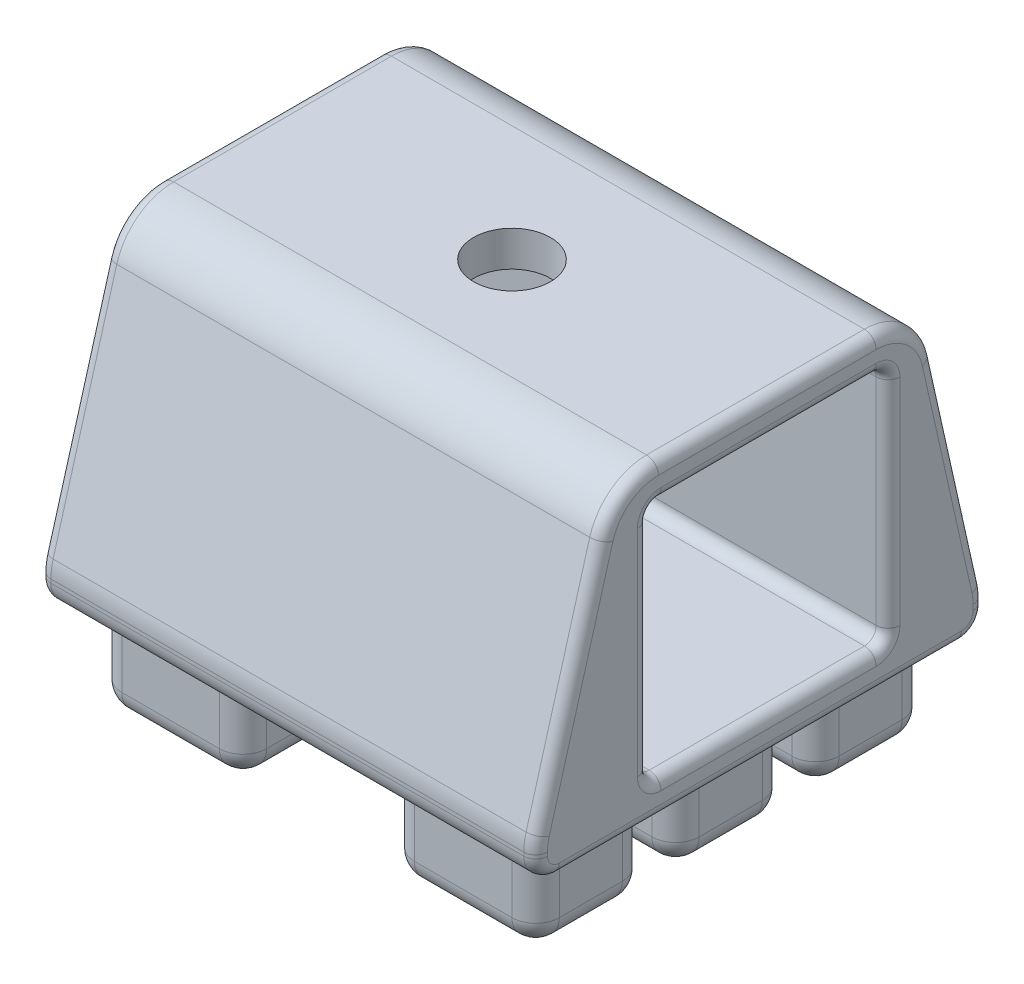
from build123d import *

# Parameters (mm, degrees)
ESBO_O1_W                = 42
ESBO_O1_H                = 38
RESSALTO_EXTRUS_O1_DEPTH = 1.5
ESBO_O2_W                = 12.25
ESBO_O2_H                = 9.333333333
ESBO_O2_H_2              = 9.333333334
RESSALTO_EXTRUS_O2_DEPTH = 7.5
FILETE1_R                = 2
RESSALTO_EXTRUS_O3_START = -21
ESBO_O5_W                = 26.2
ESBO_O5_H                = 26.2
ESBO_O5_W_2              = 20.2
ESBO_O5_H_2              = 20.2
RESSALTO_EXTRUS_O3_DEPTH = 42
ESBO_O3_R                = 3.25
CORTE_EXTRUS_O1_DEPTH    = 39.580305857
LOFT3_START              = -21
LOFT3_DEPTH              = 42
LOFT4_START              = -21
LOFT4_DEPTH              = 42
FILETE8_START            = -22
FILETE8_DEPTH            = 44
FILETE9_R                = 1
FILETE10_R               = 1
FILETE11_R               = 2


with BuildPart() as part:
    # Esboço1 → Ressalto-extrusão1 (new, symmetric)
    with BuildSketch(Plane(origin=(0, 0, 0), x_dir=(1, 0, 0), z_dir=(0, 1, 0))):
        Rectangle(ESBO_O1_W, ESBO_O1_H)
    extrude(amount=RESSALTO_EXTRUS_O1_DEPTH, both=True)

    # Esboço2 → Ressalto-extrusão2 (add)
    with BuildSketch(Plane.XZ.offset(1.5)):
        with Locations((-12.375, 11.833333334)):
            Rectangle(ESBO_O2_W, ESBO_O2_H)
        with Locations((-12.375, 0)):
            Rectangle(ESBO_O2_W, ESBO_O2_H_2)
        with Locations((12.375, 11.833333334)):
            Rectangle(ESBO_O2_W, ESBO_O2_H)
        with Locations((12.375, 0)):
            Rectangle(ESBO_O2_W, ESBO_O2_H_2)
        with Locations((-12.375, -11.833333334)):
            Rectangle(ESBO_O2_W, ESBO_O2_H)
        with Locations((12.375, -11.833333334)):
            Rectangle(ESBO_O2_W, ESBO_O2_H)
    extrude(amount=RESSALTO_EXTRUS_O2_DEPTH)

    # Filete1
    filete1_edges = [part.edges().sort_by_distance(p)[0] for p in [
        (-6.25, -5.25, 7.166666667),
        (-6.25, -5.25, 16.5),
        (-18.5, -5.25, 16.5),
        (-18.5, -5.25, 7.166666667),
        (-6.25, -9, 11.833333333),
        (-12.375, -9, 16.5),
        (-18.5, -9, 11.833333333),
        (-12.375, -9, 7.166666667),
        (18.5, -5.25, 7.166666667),
        (18.5, -5.25, 16.5),
        (6.25, -5.25, 16.5),
        (6.25, -5.25, 7.166666667),
        (18.5, -9, 11.833333333),
        (12.375, -9, 16.5),
        (6.25, -9, 11.833333333),
        (12.375, -9, 7.166666667),
        (-6.25, -5.25, -4.666666667),
        (-6.25, -5.25, 4.666666667),
        (-18.5, -5.25, 4.666666667),
        (-18.5, -5.25, -4.666666667),
        (-6.25, -9, 0),
        (-12.375, -9, 4.666666667),
        (-18.5, -9, 0),
        (-12.375, -9, -4.666666667),
        (18.5, -5.25, -4.666666667),
        (18.5, -5.25, 4.666666667),
        (6.25, -5.25, 4.666666667),
        (6.25, -5.25, -4.666666667),
        (18.5, -9, 0),
        (12.375, -9, 4.666666667),
        (6.25, -9, 0),
        (12.375, -9, -4.666666667),
        (-6.25, -5.25, -16.5),
        (-6.25, -5.25, -7.166666667),
        (-18.5, -5.25, -7.166666667),
        (-18.5, -5.25, -16.5),
        (-6.25, -9, -11.833333333),
        (-12.375, -9, -7.166666667),
        (-18.5, -9, -11.833333333),
        (-12.375, -9, -16.5),
        (18.5, -5.25, -16.5),
        (18.5, -5.25, -7.166666667),
        (6.25, -5.25, -7.166666667),
        (6.25, -5.25, -16.5),
        (18.5, -9, -11.833333333),
        (12.375, -9, -7.166666667),
        (6.25, -9, -11.833333333),
        (12.375, -9, -16.5),
    ]]
    fillet(filete1_edges, radius=FILETE1_R)

    # Esboço5 → Ressalto-extrusão3 (add)
    with BuildSketch(Plane(origin=(0, 0, 0), x_dir=(0, 0, -1), z_dir=(1, 0, 0)).offset(RESSALTO_EXTRUS_O3_START)):
        with Locations((0.705873589, 11.6)):
            Rectangle(ESBO_O5_W, ESBO_O5_H)
        with Locations((0.705873589, 11.6)):
            Rectangle(ESBO_O5_W_2, ESBO_O5_H_2, mode=Mode.SUBTRACT)
    extrude(amount=RESSALTO_EXTRUS_O3_DEPTH)

    # Esboço3 → Corte-extrusão1 (cut, through all)
    with BuildSketch(Plane.XZ.offset(1.5)):
        with Locations(Location((0, 0, 0), (0, 0, 270))):
            Circle(ESBO_O3_R)
    extrude(amount=-CORTE_EXTRUS_O1_DEPTH, mode=Mode.SUBTRACT)

    # Loft3: read off the stored shape, not the designer's step
    # Loft3 outline → Loft3 (add)
    with BuildSketch(Plane.YZ.offset(LOFT3_START)):
        Polygon((1.5, 12.394126411), (24.7, 12.394126411), (1.5, 19), align=None)
    extrude(amount=LOFT3_DEPTH)

    # Loft4: read off the stored shape, not the designer's step
    # Loft4 outline → Loft4 (add)
    with BuildSketch(Plane.YZ.offset(LOFT4_START)):
        Polygon((1.5, -13.805873589), (1.5, -19), (24.70005, -13.805862395), align=None)
    extrude(amount=LOFT4_DEPTH)

    # Filete8: read off the stored shape, not the designer's step
    # Filete8 outline → Filete8 (cut)
    with BuildSketch(Plane.YZ.offset(FILETE8_START)):
        with BuildLine():
            ThreePointArc((0.802031375, 19), (1.49329735, 18.951984587), (2.171286756, 18.808860541))
            Line((2.171286756, 18.808860541), (1.5, 19))
            Line((1.5, 19), (0.802031375, 19))
        make_face()
        with BuildLine():
            ThreePointArc((21.069255381, 13.427929858), (23.69038074, 11.631852341), (24.7, 8.619069318))
            Line((24.7, 8.619069318), (24.7, 12.394126411))
            Line((24.7, 12.394126411), (21.069255381, 13.427929858))
        make_face()
        with BuildLine():
            ThreePointArc((24.7, -9.801518542), (23.602685314, -12.927066069), (20.792381063, -14.680729914))
            Line((20.792381063, -14.680729914), (24.70005, -13.805862395))
            Line((24.70005, -13.805862395), (24.7, -9.801518542))
        make_face()
        with BuildLine():
            ThreePointArc((2.039512508, -18.879211372), (1.496650844, -18.969711101), (0.947131445, -19))
            Line((0.947131445, -19), (1.5, -19))
            Line((1.5, -19), (2.039512508, -18.879211372))
        make_face()
    extrude(amount=FILETE8_DEPTH, mode=Mode.SUBTRACT)

    # Filete9
    filete9_edges = [part.edges().sort_by_distance(p)[0] for p in [
        (0, 21.7, -10.805873589),
        (0, 21.7, 9.394126411),
        (0, 1.5, 9.394126411),
        (0, 1.5, -10.805873589),
    ]]
    fillet(filete9_edges, radius=FILETE9_R)

    # Filete10
    filete10_edges = [part.edges().sort_by_distance(p)[0] for p in [
        (-21, 1.792893219, 9.101233192),
        (21, 11.6, 9.394126411),
        (-21, 11.6, 9.394126411),
        (-21, 21.407106781, 9.101233192),
        (-21, 21.7, -0.705873589),
        (21, 21.7, -0.705873589),
        (-21, 21.407106781, -10.512980371),
        (-21, 11.6, -10.805873589),
        (21, 11.6, -10.805873589),
        (-21, 1.792893219, -10.512980371),
        (-21, 1.5, -0.705873589),
        (-21, 23.602685314, -12.927066069),
        (21, 24.7, -0.591224612),
        (-21, 24.7, -0.591224612),
        (-21, 23.69038074, 11.631852341),
        (-21, 11.620271069, 16.1183952),
        (21, 11.620271069, 16.1183952),
        (-21, 1.49329735, 18.951984587),
        (-21, -0.348984312, 19),
        (-21, -1.5, 0),
        (-21, -0.276434277, -19),
        (-21, 1.496650844, -18.969711101),
        (21, 11.415946785, -16.779970643),
        (-21, 11.415946785, -16.779970643),
        (21, 1.792893219, -10.512980371),
        (21, 21.407106781, -10.512980371),
        (21, 21.407106781, 9.101233192),
        (21, 1.792893219, 9.101233192),
        (21, 1.5, -0.705873589),
        (21, -1.5, 0),
        (21, -0.348984313, 19),
        (21, 1.49329735, 18.951984587),
        (21, 23.69038074, 11.631852341),
        (21, 23.602685314, -12.927066069),
        (21, 1.496650844, -18.969711101),
        (21, -0.276434277, -19),
    ]]
    fillet(filete10_edges, radius=FILETE10_R)

    # Filete11
    # the kernel refuses this fillet: 2 mm, written as the material it takes off along each edge
    with BuildSketch(Plane(origin=(-21, 0.5, 17), x_dir=(0, -1, 0), z_dir=(0, 0, -1))) as filete11_piece_1:
        with BuildLine():
            CenterArc((1, -1), 1, 0, 90)
            Line((2, -1), (2, 0))
            Line((2, 0), (1, 0))
        make_face()
    revolve(axis=Axis((-21, 0.5, 17), (-1, 0, 0)), revolution_arc=90, mode=Mode.SUBTRACT)
    with BuildSketch(Plane(origin=(-21, 0.5, -17), x_dir=(0, 0, -1), z_dir=(0, 1, 0))) as filete11_piece_2:
        with BuildLine():
            CenterArc((1, -1), 1, 0, 90)
            Line((2, -1), (2, 0))
            Line((2, 0), (1, 0))
        make_face()
    revolve(axis=Axis((-21, 0.5, -17), (-1, 0, 0)), revolution_arc=90, mode=Mode.SUBTRACT)
    with BuildSketch(Plane(origin=(21, 0.5, 17), x_dir=(0, 0, 1), z_dir=(0, 1, 0))) as filete11_piece_3:
        with BuildLine():
            CenterArc((1, -1), 1, 0, 90)
            Line((2, -1), (2, 0))
            Line((2, 0), (1, 0))
        make_face()
    revolve(axis=Axis((21, 0.5, 17), (1, 0, 0)), revolution_arc=90, mode=Mode.SUBTRACT)
    with BuildSketch(Plane(origin=(21, 0.5, -17), x_dir=(0, -1, 0), z_dir=(0, 0, 1))) as filete11_piece_4:
        with BuildLine():
            CenterArc((1, -1), 1, 0, 90)
            Line((2, -1), (2, 0))
            Line((2, 0), (1, 0))
        make_face()
    revolve(axis=Axis((21, 0.5, -17), (1, 0, 0)), revolution_arc=90, mode=Mode.SUBTRACT)
    with BuildSketch(Plane(origin=(-21, -1.5, 19), x_dir=(0, 1, 0), z_dir=(1, 0, 0))) as filete11_piece_5:
        with BuildLine():
            CenterArc((FILETE11_R, -FILETE11_R), FILETE11_R, 90, 90)
            Line((0, -FILETE11_R), (0, 0))
            Line((0, 0), (FILETE11_R, 0))
        make_face()
    extrude(amount=42, mode=Mode.SUBTRACT)
    with BuildSketch(Plane(origin=(21, -1.5, -19), x_dir=(0, 0, 1), z_dir=(-1, 0, 0))) as filete11_piece_6:
        with BuildLine():
            CenterArc((FILETE11_R, FILETE11_R), FILETE11_R, 180, 90)
            Line((0, FILETE11_R), (0, 0))
            Line((0, 0), (FILETE11_R, 0))
        make_face()
    extrude(amount=42, mode=Mode.SUBTRACT)


solid = part.part
